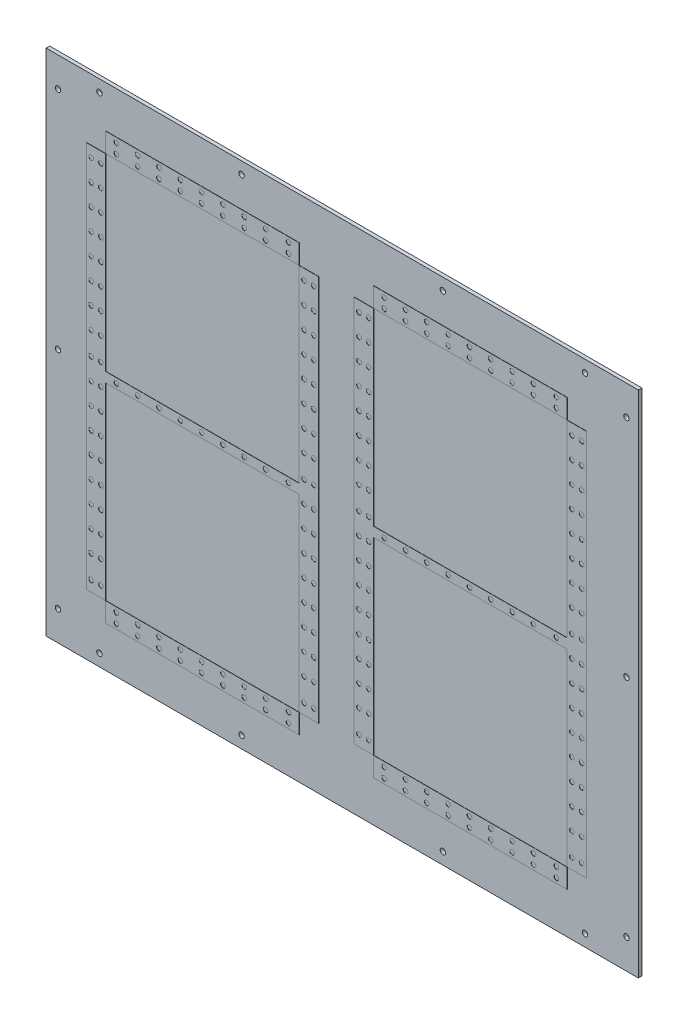
from build123d import *

# Parameters (mm, degrees)
ESBO_O4_W                = 500
ESBO_O4_H                = 430
FLANGE_BASE1_DEPTH       = 3
ESBO_O3_W                = 163.357552272
ESBO_O3_H                = 8.2
ESBO_O3_R                = 2
ESBO_O3_W_2              = 8.2
ESBO_O3_H_2              = 163.357552272
ESBO_O3_H_3              = 163.357552271
ESBO_O3_W_3              = 163.357552271
RESSALTO_EXTRUS_O1_DEPTH = 0.2
ESBO_O13_R               = 2.3
CORTE_EXTRUS_O3_DEPTH    = 3


# Sheet-metal steps are written as plain solids
with BuildPart() as part:
    # Esboço4 → Flange-base1 (new body)
    with BuildSketch(Plane.XY):
        with Locations((39.157455037, 0)):
            Rectangle(ESBO_O4_W, ESBO_O4_H)
    extrude(amount=-FLANGE_BASE1_DEPTH)

    # Esboço3 → Ressalto-extrusão1 (add)
    # profile 1 of 26: a face of its own
    with BuildSketch(Plane.XY):
        with Locations((-78.655821477, -176.090181002)):
            Rectangle(ESBO_O3_W, ESBO_O3_H)
        with Locations((-151.334597613, -176.090181002)):
            Circle(ESBO_O3_R, mode=Mode.SUBTRACT)
        with Locations((-133.334597613, -176.090181002)):
            Circle(ESBO_O3_R, mode=Mode.SUBTRACT)
        with Locations((-115.334597613, -176.090181002)):
            Circle(ESBO_O3_R, mode=Mode.SUBTRACT)
        with Locations((-97.334597613, -176.090181002)):
            Circle(ESBO_O3_R, mode=Mode.SUBTRACT)
        with Locations((-79.334597613, -176.090181002)):
            Circle(ESBO_O3_R, mode=Mode.SUBTRACT)
        with Locations((-61.334597613, -176.090181002)):
            Circle(ESBO_O3_R, mode=Mode.SUBTRACT)
        with Locations((-43.334597613, -176.090181002)):
            Circle(ESBO_O3_R, mode=Mode.SUBTRACT)
        with Locations((-25.334597613, -176.090181002)):
            Circle(ESBO_O3_R, mode=Mode.SUBTRACT)
        with Locations((-5.977045341, -176.090181002)):
            Circle(ESBO_O3_R, mode=Mode.SUBTRACT)
    # profile 2 of 26: a face of its own
    with BuildSketch(Plane.XY):
        with Locations((-78.655821477, -167.890181002)):
            Rectangle(ESBO_O3_W, ESBO_O3_H)
        with Locations((-151.334597613, -167.890181002)):
            Circle(ESBO_O3_R, mode=Mode.SUBTRACT)
        with Locations((-133.334597613, -167.890181002)):
            Circle(ESBO_O3_R, mode=Mode.SUBTRACT)
        with Locations((-115.334597613, -167.890181002)):
            Circle(ESBO_O3_R, mode=Mode.SUBTRACT)
        with Locations((-97.334597613, -167.890181002)):
            Circle(ESBO_O3_R, mode=Mode.SUBTRACT)
        with Locations((-79.334597613, -167.890181002)):
            Circle(ESBO_O3_R, mode=Mode.SUBTRACT)
        with Locations((-61.334597613, -167.890181002)):
            Circle(ESBO_O3_R, mode=Mode.SUBTRACT)
        with Locations((-43.334597613, -167.890181002)):
            Circle(ESBO_O3_R, mode=Mode.SUBTRACT)
        with Locations((-25.334597613, -167.890181002)):
            Circle(ESBO_O3_R, mode=Mode.SUBTRACT)
        with Locations((-5.977045341, -167.890181002)):
            Circle(ESBO_O3_R, mode=Mode.SUBTRACT)
    # profile 3 of 26: a face of its own
    with BuildSketch(Plane.XY):
        Polygon((-160.334597613, -4.412072557), (3.022954659, -4.412072557), (3.022954659, -0.312072557), (3.022954659, 3.787927443), (-160.334597613, 3.787927443), (-160.334597613, -0.312072557), align=None)
        with Locations((-151.334597613, -0.312072557)):
            Circle(ESBO_O3_R, mode=Mode.SUBTRACT)
        with Locations((-133.334597613, -0.312072557)):
            Circle(ESBO_O3_R, mode=Mode.SUBTRACT)
        with Locations((-115.334597613, -0.312072557)):
            Circle(ESBO_O3_R, mode=Mode.SUBTRACT)
        with Locations((-97.334597613, -0.312072557)):
            Circle(ESBO_O3_R, mode=Mode.SUBTRACT)
        with Locations((-79.334597613, -0.312072557)):
            Circle(ESBO_O3_R, mode=Mode.SUBTRACT)
        with Locations((-61.334597613, -0.312072557)):
            Circle(ESBO_O3_R, mode=Mode.SUBTRACT)
        with Locations((-43.334597613, -0.312072557)):
            Circle(ESBO_O3_R, mode=Mode.SUBTRACT)
        with Locations((-25.334597613, -0.312072557)):
            Circle(ESBO_O3_R, mode=Mode.SUBTRACT)
        with Locations((-5.977045341, -0.312072557)):
            Circle(ESBO_O3_R, mode=Mode.SUBTRACT)
    # profile 4 of 26: a face of its own
    with BuildSketch(Plane.XY):
        Polygon((3.022954659, -0.312072557), (3.022954659, -4.412072557), (3.022954659, -163.669624829), (11.222954659, -163.669624829), (11.222954659, -0.312072557), align=None)
        with Locations((7.122954659, -154.669624829)):
            Circle(ESBO_O3_R, mode=Mode.SUBTRACT)
        with Locations((7.122954659, -135.312072557)):
            Circle(ESBO_O3_R, mode=Mode.SUBTRACT)
        with Locations((7.122954659, -117.312072557)):
            Circle(ESBO_O3_R, mode=Mode.SUBTRACT)
        with Locations((7.122954659, -99.312072557)):
            Circle(ESBO_O3_R, mode=Mode.SUBTRACT)
        with Locations((7.122954659, -81.312072557)):
            Circle(ESBO_O3_R, mode=Mode.SUBTRACT)
        with Locations((7.122954659, -63.312072557)):
            Circle(ESBO_O3_R, mode=Mode.SUBTRACT)
        with Locations((7.122954659, -45.312072557)):
            Circle(ESBO_O3_R, mode=Mode.SUBTRACT)
        with Locations((7.122954659, -27.312072557)):
            Circle(ESBO_O3_R, mode=Mode.SUBTRACT)
        with Locations((7.122954659, -9.312072557)):
            Circle(ESBO_O3_R, mode=Mode.SUBTRACT)
    # profile 5 of 26: a face of its own
    with BuildSketch(Plane.XY):
        Polygon((-160.334597613, -163.669624829), (-160.334597613, -4.412072557), (-160.334597613, -0.312072557), (-168.534597613, -0.312072557), (-168.534597613, -163.669624829), align=None)
        with Locations((-164.434597613, -154.669624829)):
            Circle(ESBO_O3_R, mode=Mode.SUBTRACT)
        with Locations((-164.434597613, -135.312072557)):
            Circle(ESBO_O3_R, mode=Mode.SUBTRACT)
        with Locations((-164.434597613, -117.312072557)):
            Circle(ESBO_O3_R, mode=Mode.SUBTRACT)
        with Locations((-164.434597613, -99.312072557)):
            Circle(ESBO_O3_R, mode=Mode.SUBTRACT)
        with Locations((-164.434597613, -81.312072557)):
            Circle(ESBO_O3_R, mode=Mode.SUBTRACT)
        with Locations((-164.434597613, -63.312072557)):
            Circle(ESBO_O3_R, mode=Mode.SUBTRACT)
        with Locations((-164.434597613, -45.312072557)):
            Circle(ESBO_O3_R, mode=Mode.SUBTRACT)
        with Locations((-164.434597613, -27.312072557)):
            Circle(ESBO_O3_R, mode=Mode.SUBTRACT)
        with Locations((-164.434597613, -9.312072557)):
            Circle(ESBO_O3_R, mode=Mode.SUBTRACT)
    # profile 6 of 26: a face of its own
    with BuildSketch(Plane.XY):
        Polygon((3.022954659, 3.787927443), (3.022954659, -0.312072557), (11.222954659, -0.312072557), (11.222954659, 163.045479714), (3.022954659, 163.045479714), align=None)
        with Locations((7.122954659, 8.687927443)):
            Circle(ESBO_O3_R, mode=Mode.SUBTRACT)
        with Locations((7.122954659, 28.045479714)):
            Circle(ESBO_O3_R, mode=Mode.SUBTRACT)
        with Locations((7.122954659, 46.045479714)):
            Circle(ESBO_O3_R, mode=Mode.SUBTRACT)
        with Locations((7.122954659, 64.045479714)):
            Circle(ESBO_O3_R, mode=Mode.SUBTRACT)
        with Locations((7.122954659, 82.045479714)):
            Circle(ESBO_O3_R, mode=Mode.SUBTRACT)
        with Locations((7.122954659, 100.045479714)):
            Circle(ESBO_O3_R, mode=Mode.SUBTRACT)
        with Locations((7.122954659, 118.045479714)):
            Circle(ESBO_O3_R, mode=Mode.SUBTRACT)
        with Locations((7.122954659, 136.045479714)):
            Circle(ESBO_O3_R, mode=Mode.SUBTRACT)
        with Locations((7.122954659, 154.045479714)):
            Circle(ESBO_O3_R, mode=Mode.SUBTRACT)
    # profile 7 of 26: a face of its own
    with BuildSketch(Plane.XY):
        Polygon((-168.534597613, -0.312072557), (-160.334597613, -0.312072557), (-160.334597613, 3.787927443), (-160.334597613, 163.045479714), (-168.534597613, 163.045479714), align=None)
        with Locations((-164.434597613, 8.687927443)):
            Circle(ESBO_O3_R, mode=Mode.SUBTRACT)
        with Locations((-164.434597613, 28.045479714)):
            Circle(ESBO_O3_R, mode=Mode.SUBTRACT)
        with Locations((-164.434597613, 46.045479714)):
            Circle(ESBO_O3_R, mode=Mode.SUBTRACT)
        with Locations((-164.434597613, 64.045479714)):
            Circle(ESBO_O3_R, mode=Mode.SUBTRACT)
        with Locations((-164.434597613, 82.045479714)):
            Circle(ESBO_O3_R, mode=Mode.SUBTRACT)
        with Locations((-164.434597613, 100.045479714)):
            Circle(ESBO_O3_R, mode=Mode.SUBTRACT)
        with Locations((-164.434597613, 118.045479714)):
            Circle(ESBO_O3_R, mode=Mode.SUBTRACT)
        with Locations((-164.434597613, 136.045479714)):
            Circle(ESBO_O3_R, mode=Mode.SUBTRACT)
        with Locations((-164.434597613, 154.045479714)):
            Circle(ESBO_O3_R, mode=Mode.SUBTRACT)
    # profile 8 of 26: a face of its own
    with BuildSketch(Plane.XY):
        with Locations((15.322954659, -81.990848693)):
            Rectangle(ESBO_O3_W_2, ESBO_O3_H_2)
        with Locations((15.322954659, -154.669624829)):
            Circle(ESBO_O3_R, mode=Mode.SUBTRACT)
        with Locations((15.322954659, -135.312072557)):
            Circle(ESBO_O3_R, mode=Mode.SUBTRACT)
        with Locations((15.322954659, -117.312072557)):
            Circle(ESBO_O3_R, mode=Mode.SUBTRACT)
        with Locations((15.322954659, -99.312072557)):
            Circle(ESBO_O3_R, mode=Mode.SUBTRACT)
        with Locations((15.322954659, -81.312072557)):
            Circle(ESBO_O3_R, mode=Mode.SUBTRACT)
        with Locations((15.322954659, -63.312072557)):
            Circle(ESBO_O3_R, mode=Mode.SUBTRACT)
        with Locations((15.322954659, -45.312072557)):
            Circle(ESBO_O3_R, mode=Mode.SUBTRACT)
        with Locations((15.322954659, -27.312072557)):
            Circle(ESBO_O3_R, mode=Mode.SUBTRACT)
        with Locations((15.322954659, -9.312072557)):
            Circle(ESBO_O3_R, mode=Mode.SUBTRACT)
    # profile 9 of 26: a face of its own
    with BuildSketch(Plane.XY):
        with Locations((15.322954659, 81.366703579)):
            Rectangle(ESBO_O3_W_2, ESBO_O3_H_3)
        with Locations((15.322954659, 8.687927443)):
            Circle(ESBO_O3_R, mode=Mode.SUBTRACT)
        with Locations((15.322954659, 28.045479714)):
            Circle(ESBO_O3_R, mode=Mode.SUBTRACT)
        with Locations((15.322954659, 46.045479714)):
            Circle(ESBO_O3_R, mode=Mode.SUBTRACT)
        with Locations((15.322954659, 64.045479714)):
            Circle(ESBO_O3_R, mode=Mode.SUBTRACT)
        with Locations((15.322954659, 82.045479714)):
            Circle(ESBO_O3_R, mode=Mode.SUBTRACT)
        with Locations((15.322954659, 100.045479714)):
            Circle(ESBO_O3_R, mode=Mode.SUBTRACT)
        with Locations((15.322954659, 118.045479714)):
            Circle(ESBO_O3_R, mode=Mode.SUBTRACT)
        with Locations((15.322954659, 136.045479714)):
            Circle(ESBO_O3_R, mode=Mode.SUBTRACT)
        with Locations((15.322954659, 154.045479714)):
            Circle(ESBO_O3_R, mode=Mode.SUBTRACT)
    # profile 10 of 26: a face of its own
    with BuildSketch(Plane.XY):
        with Locations((-172.634597613, 81.366703579)):
            Rectangle(ESBO_O3_W_2, ESBO_O3_H_3)
        with Locations((-172.634597613, 8.687927443)):
            Circle(ESBO_O3_R, mode=Mode.SUBTRACT)
        with Locations((-172.634597613, 28.045479714)):
            Circle(ESBO_O3_R, mode=Mode.SUBTRACT)
        with Locations((-172.634597613, 46.045479714)):
            Circle(ESBO_O3_R, mode=Mode.SUBTRACT)
        with Locations((-172.634597613, 64.045479714)):
            Circle(ESBO_O3_R, mode=Mode.SUBTRACT)
        with Locations((-172.634597613, 82.045479714)):
            Circle(ESBO_O3_R, mode=Mode.SUBTRACT)
        with Locations((-172.634597613, 100.045479714)):
            Circle(ESBO_O3_R, mode=Mode.SUBTRACT)
        with Locations((-172.634597613, 118.045479714)):
            Circle(ESBO_O3_R, mode=Mode.SUBTRACT)
        with Locations((-172.634597613, 136.045479714)):
            Circle(ESBO_O3_R, mode=Mode.SUBTRACT)
        with Locations((-172.634597613, 154.045479714)):
            Circle(ESBO_O3_R, mode=Mode.SUBTRACT)
    # profile 11 of 26: a face of its own
    with BuildSketch(Plane.XY):
        with Locations((-172.634597613, -81.990848693)):
            Rectangle(ESBO_O3_W_2, ESBO_O3_H_2)
        with Locations((-172.634597613, -154.669624829)):
            Circle(ESBO_O3_R, mode=Mode.SUBTRACT)
        with Locations((-172.634597613, -135.312072557)):
            Circle(ESBO_O3_R, mode=Mode.SUBTRACT)
        with Locations((-172.634597613, -117.312072557)):
            Circle(ESBO_O3_R, mode=Mode.SUBTRACT)
        with Locations((-172.634597613, -99.312072557)):
            Circle(ESBO_O3_R, mode=Mode.SUBTRACT)
        with Locations((-172.634597613, -81.312072557)):
            Circle(ESBO_O3_R, mode=Mode.SUBTRACT)
        with Locations((-172.634597613, -63.312072557)):
            Circle(ESBO_O3_R, mode=Mode.SUBTRACT)
        with Locations((-172.634597613, -45.312072557)):
            Circle(ESBO_O3_R, mode=Mode.SUBTRACT)
        with Locations((-172.634597613, -27.312072557)):
            Circle(ESBO_O3_R, mode=Mode.SUBTRACT)
        with Locations((-172.634597613, -9.312072557)):
            Circle(ESBO_O3_R, mode=Mode.SUBTRACT)
    # profile 12 of 26: a face of its own
    with BuildSketch(Plane.XY):
        with Locations((-78.662362751, 167.278154522)):
            Rectangle(ESBO_O3_W_3, ESBO_O3_H)
        with Locations((-151.341138886, 167.278154522)):
            Circle(ESBO_O3_R, mode=Mode.SUBTRACT)
        with Locations((-133.341138886, 167.278154522)):
            Circle(ESBO_O3_R, mode=Mode.SUBTRACT)
        with Locations((-115.341138886, 167.278154522)):
            Circle(ESBO_O3_R, mode=Mode.SUBTRACT)
        with Locations((-97.341138886, 167.278154522)):
            Circle(ESBO_O3_R, mode=Mode.SUBTRACT)
        with Locations((-79.341138886, 167.278154522)):
            Circle(ESBO_O3_R, mode=Mode.SUBTRACT)
        with Locations((-61.341138886, 167.278154522)):
            Circle(ESBO_O3_R, mode=Mode.SUBTRACT)
        with Locations((-43.341138886, 167.278154522)):
            Circle(ESBO_O3_R, mode=Mode.SUBTRACT)
        with Locations((-25.341138886, 167.278154522)):
            Circle(ESBO_O3_R, mode=Mode.SUBTRACT)
        with Locations((-5.983586615, 167.278154522)):
            Circle(ESBO_O3_R, mode=Mode.SUBTRACT)
    # profile 13 of 26: a face of its own
    with BuildSketch(Plane.XY):
        with Locations((-78.662362751, 175.478154522)):
            Rectangle(ESBO_O3_W_3, ESBO_O3_H)
        with Locations((-151.341138886, 175.478154522)):
            Circle(ESBO_O3_R, mode=Mode.SUBTRACT)
        with Locations((-133.341138886, 175.478154522)):
            Circle(ESBO_O3_R, mode=Mode.SUBTRACT)
        with Locations((-115.341138886, 175.478154522)):
            Circle(ESBO_O3_R, mode=Mode.SUBTRACT)
        with Locations((-97.341138886, 175.478154522)):
            Circle(ESBO_O3_R, mode=Mode.SUBTRACT)
        with Locations((-79.341138886, 175.478154522)):
            Circle(ESBO_O3_R, mode=Mode.SUBTRACT)
        with Locations((-61.341138886, 175.478154522)):
            Circle(ESBO_O3_R, mode=Mode.SUBTRACT)
        with Locations((-43.341138886, 175.478154522)):
            Circle(ESBO_O3_R, mode=Mode.SUBTRACT)
        with Locations((-25.341138886, 175.478154522)):
            Circle(ESBO_O3_R, mode=Mode.SUBTRACT)
        with Locations((-5.983586615, 175.478154522)):
            Circle(ESBO_O3_R, mode=Mode.SUBTRACT)
    # profile 14 of 26: a face of its own
    with BuildSketch(Plane.XY):
        with Locations((147.501730795, -176.090181002)):
            Rectangle(ESBO_O3_W_3, ESBO_O3_H)
        with Locations((74.822954659, -176.090181002)):
            Circle(ESBO_O3_R, mode=Mode.SUBTRACT)
        with Locations((92.822954659, -176.090181002)):
            Circle(ESBO_O3_R, mode=Mode.SUBTRACT)
        with Locations((110.822954659, -176.090181002)):
            Circle(ESBO_O3_R, mode=Mode.SUBTRACT)
        with Locations((128.822954659, -176.090181002)):
            Circle(ESBO_O3_R, mode=Mode.SUBTRACT)
        with Locations((146.822954659, -176.090181002)):
            Circle(ESBO_O3_R, mode=Mode.SUBTRACT)
        with Locations((164.822954659, -176.090181002)):
            Circle(ESBO_O3_R, mode=Mode.SUBTRACT)
        with Locations((182.822954659, -176.090181002)):
            Circle(ESBO_O3_R, mode=Mode.SUBTRACT)
        with Locations((200.822954659, -176.090181002)):
            Circle(ESBO_O3_R, mode=Mode.SUBTRACT)
        with Locations((220.18050693, -176.090181002)):
            Circle(ESBO_O3_R, mode=Mode.SUBTRACT)
    # profile 15 of 26: a face of its own
    with BuildSketch(Plane.XY):
        with Locations((147.501730795, -167.890181002)):
            Rectangle(ESBO_O3_W_3, ESBO_O3_H)
        with Locations((74.822954659, -167.890181002)):
            Circle(ESBO_O3_R, mode=Mode.SUBTRACT)
        with Locations((92.822954659, -167.890181002)):
            Circle(ESBO_O3_R, mode=Mode.SUBTRACT)
        with Locations((110.822954659, -167.890181002)):
            Circle(ESBO_O3_R, mode=Mode.SUBTRACT)
        with Locations((128.822954659, -167.890181002)):
            Circle(ESBO_O3_R, mode=Mode.SUBTRACT)
        with Locations((146.822954659, -167.890181002)):
            Circle(ESBO_O3_R, mode=Mode.SUBTRACT)
        with Locations((164.822954659, -167.890181002)):
            Circle(ESBO_O3_R, mode=Mode.SUBTRACT)
        with Locations((182.822954659, -167.890181002)):
            Circle(ESBO_O3_R, mode=Mode.SUBTRACT)
        with Locations((200.822954659, -167.890181002)):
            Circle(ESBO_O3_R, mode=Mode.SUBTRACT)
        with Locations((220.18050693, -167.890181002)):
            Circle(ESBO_O3_R, mode=Mode.SUBTRACT)
    # profile 16 of 26: a face of its own
    with BuildSketch(Plane.XY):
        Polygon((65.822954659, -4.412072557), (229.18050693, -4.412072557), (229.18050693, -0.312072557), (229.18050693, 3.787927443), (65.822954659, 3.787927443), (65.822954659, -0.312072557), align=None)
        with Locations((74.822954659, -0.312072557)):
            Circle(ESBO_O3_R, mode=Mode.SUBTRACT)
        with Locations((92.822954659, -0.312072557)):
            Circle(ESBO_O3_R, mode=Mode.SUBTRACT)
        with Locations((110.822954659, -0.312072557)):
            Circle(ESBO_O3_R, mode=Mode.SUBTRACT)
        with Locations((128.822954659, -0.312072557)):
            Circle(ESBO_O3_R, mode=Mode.SUBTRACT)
        with Locations((146.822954659, -0.312072557)):
            Circle(ESBO_O3_R, mode=Mode.SUBTRACT)
        with Locations((164.822954659, -0.312072557)):
            Circle(ESBO_O3_R, mode=Mode.SUBTRACT)
        with Locations((182.822954659, -0.312072557)):
            Circle(ESBO_O3_R, mode=Mode.SUBTRACT)
        with Locations((200.822954659, -0.312072557)):
            Circle(ESBO_O3_R, mode=Mode.SUBTRACT)
        with Locations((220.18050693, -0.312072557)):
            Circle(ESBO_O3_R, mode=Mode.SUBTRACT)
    # profile 17 of 26: a face of its own
    with BuildSketch(Plane.XY):
        Polygon((229.18050693, -0.312072557), (229.18050693, -4.412072557), (229.18050693, -163.669624829), (237.38050693, -163.669624829), (237.38050693, -0.312072557), align=None)
        with Locations((233.28050693, -154.669624829)):
            Circle(ESBO_O3_R, mode=Mode.SUBTRACT)
        with Locations((233.28050693, -135.312072557)):
            Circle(ESBO_O3_R, mode=Mode.SUBTRACT)
        with Locations((233.28050693, -117.312072557)):
            Circle(ESBO_O3_R, mode=Mode.SUBTRACT)
        with Locations((233.28050693, -99.312072557)):
            Circle(ESBO_O3_R, mode=Mode.SUBTRACT)
        with Locations((233.28050693, -81.312072557)):
            Circle(ESBO_O3_R, mode=Mode.SUBTRACT)
        with Locations((233.28050693, -63.312072557)):
            Circle(ESBO_O3_R, mode=Mode.SUBTRACT)
        with Locations((233.28050693, -45.312072557)):
            Circle(ESBO_O3_R, mode=Mode.SUBTRACT)
        with Locations((233.28050693, -27.312072557)):
            Circle(ESBO_O3_R, mode=Mode.SUBTRACT)
        with Locations((233.28050693, -9.312072557)):
            Circle(ESBO_O3_R, mode=Mode.SUBTRACT)
    # profile 18 of 26: a face of its own
    with BuildSketch(Plane.XY):
        Polygon((65.822954659, -163.669624829), (65.822954659, -4.412072557), (65.822954659, -0.312072557), (57.622954659, -0.312072557), (57.622954659, -163.669624829), align=None)
        with Locations((61.722954659, -154.669624829)):
            Circle(ESBO_O3_R, mode=Mode.SUBTRACT)
        with Locations((61.722954659, -135.312072557)):
            Circle(ESBO_O3_R, mode=Mode.SUBTRACT)
        with Locations((61.722954659, -117.312072557)):
            Circle(ESBO_O3_R, mode=Mode.SUBTRACT)
        with Locations((61.722954659, -99.312072557)):
            Circle(ESBO_O3_R, mode=Mode.SUBTRACT)
        with Locations((61.722954659, -81.312072557)):
            Circle(ESBO_O3_R, mode=Mode.SUBTRACT)
        with Locations((61.722954659, -63.312072557)):
            Circle(ESBO_O3_R, mode=Mode.SUBTRACT)
        with Locations((61.722954659, -45.312072557)):
            Circle(ESBO_O3_R, mode=Mode.SUBTRACT)
        with Locations((61.722954659, -27.312072557)):
            Circle(ESBO_O3_R, mode=Mode.SUBTRACT)
        with Locations((61.722954659, -9.312072557)):
            Circle(ESBO_O3_R, mode=Mode.SUBTRACT)
    # profile 19 of 26: a face of its own
    with BuildSketch(Plane.XY):
        Polygon((229.18050693, 3.787927443), (229.18050693, -0.312072557), (237.38050693, -0.312072557), (237.38050693, 163.045479714), (229.18050693, 163.045479714), align=None)
        with Locations((233.28050693, 8.687927443)):
            Circle(ESBO_O3_R, mode=Mode.SUBTRACT)
        with Locations((233.28050693, 28.045479714)):
            Circle(ESBO_O3_R, mode=Mode.SUBTRACT)
        with Locations((233.28050693, 46.045479714)):
            Circle(ESBO_O3_R, mode=Mode.SUBTRACT)
        with Locations((233.28050693, 64.045479714)):
            Circle(ESBO_O3_R, mode=Mode.SUBTRACT)
        with Locations((233.28050693, 82.045479714)):
            Circle(ESBO_O3_R, mode=Mode.SUBTRACT)
        with Locations((233.28050693, 100.045479714)):
            Circle(ESBO_O3_R, mode=Mode.SUBTRACT)
        with Locations((233.28050693, 118.045479714)):
            Circle(ESBO_O3_R, mode=Mode.SUBTRACT)
        with Locations((233.28050693, 136.045479714)):
            Circle(ESBO_O3_R, mode=Mode.SUBTRACT)
        with Locations((233.28050693, 154.045479714)):
            Circle(ESBO_O3_R, mode=Mode.SUBTRACT)
    # profile 20 of 26: a face of its own
    with BuildSketch(Plane.XY):
        Polygon((57.622954659, -0.312072557), (65.822954659, -0.312072557), (65.822954659, 3.787927443), (65.822954659, 163.045479714), (57.622954659, 163.045479714), align=None)
        with Locations((61.722954659, 8.687927443)):
            Circle(ESBO_O3_R, mode=Mode.SUBTRACT)
        with Locations((61.722954659, 28.045479714)):
            Circle(ESBO_O3_R, mode=Mode.SUBTRACT)
        with Locations((61.722954659, 46.045479714)):
            Circle(ESBO_O3_R, mode=Mode.SUBTRACT)
        with Locations((61.722954659, 64.045479714)):
            Circle(ESBO_O3_R, mode=Mode.SUBTRACT)
        with Locations((61.722954659, 82.045479714)):
            Circle(ESBO_O3_R, mode=Mode.SUBTRACT)
        with Locations((61.722954659, 100.045479714)):
            Circle(ESBO_O3_R, mode=Mode.SUBTRACT)
        with Locations((61.722954659, 118.045479714)):
            Circle(ESBO_O3_R, mode=Mode.SUBTRACT)
        with Locations((61.722954659, 136.045479714)):
            Circle(ESBO_O3_R, mode=Mode.SUBTRACT)
        with Locations((61.722954659, 154.045479714)):
            Circle(ESBO_O3_R, mode=Mode.SUBTRACT)
    # profile 21 of 26: a face of its own
    with BuildSketch(Plane.XY):
        with Locations((241.48050693, -81.990848693)):
            Rectangle(ESBO_O3_W_2, ESBO_O3_H_2)
        with Locations((241.48050693, -154.669624829)):
            Circle(ESBO_O3_R, mode=Mode.SUBTRACT)
        with Locations((241.48050693, -135.312072557)):
            Circle(ESBO_O3_R, mode=Mode.SUBTRACT)
        with Locations((241.48050693, -117.312072557)):
            Circle(ESBO_O3_R, mode=Mode.SUBTRACT)
        with Locations((241.48050693, -99.312072557)):
            Circle(ESBO_O3_R, mode=Mode.SUBTRACT)
        with Locations((241.48050693, -81.312072557)):
            Circle(ESBO_O3_R, mode=Mode.SUBTRACT)
        with Locations((241.48050693, -63.312072557)):
            Circle(ESBO_O3_R, mode=Mode.SUBTRACT)
        with Locations((241.48050693, -45.312072557)):
            Circle(ESBO_O3_R, mode=Mode.SUBTRACT)
        with Locations((241.48050693, -27.312072557)):
            Circle(ESBO_O3_R, mode=Mode.SUBTRACT)
        with Locations((241.48050693, -9.312072557)):
            Circle(ESBO_O3_R, mode=Mode.SUBTRACT)
    # profile 22 of 26: a face of its own
    with BuildSketch(Plane.XY):
        with Locations((241.48050693, 81.366703579)):
            Rectangle(ESBO_O3_W_2, ESBO_O3_H_3)
        with Locations((241.48050693, 8.687927443)):
            Circle(ESBO_O3_R, mode=Mode.SUBTRACT)
        with Locations((241.48050693, 28.045479714)):
            Circle(ESBO_O3_R, mode=Mode.SUBTRACT)
        with Locations((241.48050693, 46.045479714)):
            Circle(ESBO_O3_R, mode=Mode.SUBTRACT)
        with Locations((241.48050693, 64.045479714)):
            Circle(ESBO_O3_R, mode=Mode.SUBTRACT)
        with Locations((241.48050693, 82.045479714)):
            Circle(ESBO_O3_R, mode=Mode.SUBTRACT)
        with Locations((241.48050693, 100.045479714)):
            Circle(ESBO_O3_R, mode=Mode.SUBTRACT)
        with Locations((241.48050693, 118.045479714)):
            Circle(ESBO_O3_R, mode=Mode.SUBTRACT)
        with Locations((241.48050693, 136.045479714)):
            Circle(ESBO_O3_R, mode=Mode.SUBTRACT)
        with Locations((241.48050693, 154.045479714)):
            Circle(ESBO_O3_R, mode=Mode.SUBTRACT)
    # profile 23 of 26: a face of its own
    with BuildSketch(Plane.XY):
        with Locations((53.522954659, 81.366703579)):
            Rectangle(ESBO_O3_W_2, ESBO_O3_H_3)
        with Locations((53.522954659, 8.687927443)):
            Circle(ESBO_O3_R, mode=Mode.SUBTRACT)
        with Locations((53.522954659, 28.045479714)):
            Circle(ESBO_O3_R, mode=Mode.SUBTRACT)
        with Locations((53.522954659, 46.045479714)):
            Circle(ESBO_O3_R, mode=Mode.SUBTRACT)
        with Locations((53.522954659, 64.045479714)):
            Circle(ESBO_O3_R, mode=Mode.SUBTRACT)
        with Locations((53.522954659, 82.045479714)):
            Circle(ESBO_O3_R, mode=Mode.SUBTRACT)
        with Locations((53.522954659, 100.045479714)):
            Circle(ESBO_O3_R, mode=Mode.SUBTRACT)
        with Locations((53.522954659, 118.045479714)):
            Circle(ESBO_O3_R, mode=Mode.SUBTRACT)
        with Locations((53.522954659, 136.045479714)):
            Circle(ESBO_O3_R, mode=Mode.SUBTRACT)
        with Locations((53.522954659, 154.045479714)):
            Circle(ESBO_O3_R, mode=Mode.SUBTRACT)
    # profile 24 of 26: a face of its own
    with BuildSketch(Plane.XY):
        with Locations((53.522954659, -81.990848693)):
            Rectangle(ESBO_O3_W_2, ESBO_O3_H_2)
        with Locations((53.522954659, -154.669624829)):
            Circle(ESBO_O3_R, mode=Mode.SUBTRACT)
        with Locations((53.522954659, -135.312072557)):
            Circle(ESBO_O3_R, mode=Mode.SUBTRACT)
        with Locations((53.522954659, -117.312072557)):
            Circle(ESBO_O3_R, mode=Mode.SUBTRACT)
        with Locations((53.522954659, -99.312072557)):
            Circle(ESBO_O3_R, mode=Mode.SUBTRACT)
        with Locations((53.522954659, -81.312072557)):
            Circle(ESBO_O3_R, mode=Mode.SUBTRACT)
        with Locations((53.522954659, -63.312072557)):
            Circle(ESBO_O3_R, mode=Mode.SUBTRACT)
        with Locations((53.522954659, -45.312072557)):
            Circle(ESBO_O3_R, mode=Mode.SUBTRACT)
        with Locations((53.522954659, -27.312072557)):
            Circle(ESBO_O3_R, mode=Mode.SUBTRACT)
        with Locations((53.522954659, -9.312072557)):
            Circle(ESBO_O3_R, mode=Mode.SUBTRACT)
    # profile 25 of 26: a face of its own
    with BuildSketch(Plane.XY):
        with Locations((147.495189521, 167.278154522)):
            Rectangle(ESBO_O3_W, ESBO_O3_H)
        with Locations((74.816413385, 167.278154522)):
            Circle(ESBO_O3_R, mode=Mode.SUBTRACT)
        with Locations((92.816413385, 167.278154522)):
            Circle(ESBO_O3_R, mode=Mode.SUBTRACT)
        with Locations((110.816413385, 167.278154522)):
            Circle(ESBO_O3_R, mode=Mode.SUBTRACT)
        with Locations((128.816413385, 167.278154522)):
            Circle(ESBO_O3_R, mode=Mode.SUBTRACT)
        with Locations((146.816413385, 167.278154522)):
            Circle(ESBO_O3_R, mode=Mode.SUBTRACT)
        with Locations((164.816413385, 167.278154522)):
            Circle(ESBO_O3_R, mode=Mode.SUBTRACT)
        with Locations((182.816413385, 167.278154522)):
            Circle(ESBO_O3_R, mode=Mode.SUBTRACT)
        with Locations((200.816413385, 167.278154522)):
            Circle(ESBO_O3_R, mode=Mode.SUBTRACT)
        with Locations((220.173965657, 167.278154522)):
            Circle(ESBO_O3_R, mode=Mode.SUBTRACT)
    # profile 26 of 26: a face of its own
    with BuildSketch(Plane.XY):
        with Locations((147.495189521, 175.478154522)):
            Rectangle(ESBO_O3_W, ESBO_O3_H)
        with Locations((74.816413385, 175.478154522)):
            Circle(ESBO_O3_R, mode=Mode.SUBTRACT)
        with Locations((92.816413385, 175.478154522)):
            Circle(ESBO_O3_R, mode=Mode.SUBTRACT)
        with Locations((110.816413385, 175.478154522)):
            Circle(ESBO_O3_R, mode=Mode.SUBTRACT)
        with Locations((128.816413385, 175.478154522)):
            Circle(ESBO_O3_R, mode=Mode.SUBTRACT)
        with Locations((146.816413385, 175.478154522)):
            Circle(ESBO_O3_R, mode=Mode.SUBTRACT)
        with Locations((164.816413385, 175.478154522)):
            Circle(ESBO_O3_R, mode=Mode.SUBTRACT)
        with Locations((182.816413385, 175.478154522)):
            Circle(ESBO_O3_R, mode=Mode.SUBTRACT)
        with Locations((200.816413385, 175.478154522)):
            Circle(ESBO_O3_R, mode=Mode.SUBTRACT)
        with Locations((220.173965657, 175.478154522)):
            Circle(ESBO_O3_R, mode=Mode.SUBTRACT)
    extrude(amount=RESSALTO_EXTRUS_O1_DEPTH)

    # Esboço13 → Corte-extrusão3 (cut)
    with BuildSketch(Plane.XY):
        with Locations((-165.842544963, 205)):
            Circle(ESBO_O13_R)
        with Locations((-200.842544963, 190)):
            Circle(ESBO_O13_R)
        with Locations((-45.842544963, 205)):
            Circle(ESBO_O13_R)
        with Locations(Location((124.157455037, 205, 0), (0, 0, 180))):
            Circle(ESBO_O13_R)
        with Locations(Location((244.157455037, 205, 0), (0, 0, 180))):
            Circle(ESBO_O13_R)
        with Locations(Location((279.157455037, 190, 0), (0, 0, 180))):
            Circle(ESBO_O13_R)
        with Locations((279.157455037, -190)):
            Circle(ESBO_O13_R)
        with Locations((244.157455037, -205)):
            Circle(ESBO_O13_R)
        with Locations((124.157455037, -205)):
            Circle(ESBO_O13_R)
        with Locations(Location((-45.842544963, -205, 0), (0, 0, 180))):
            Circle(ESBO_O13_R)
        with Locations(Location((-200.842544963, -190, 0), (0, 0, 180))):
            Circle(ESBO_O13_R)
        with Locations(Location((-165.842544963, -205, 0), (0, 0, 180))):
            Circle(ESBO_O13_R)
        with Locations((240, 0)):
            Circle(ESBO_O13_R)
        with Locations((-200.842544963, -0.312072557)):
            Circle(ESBO_O13_R)
        with Locations((279.157455037, 0)):
            Circle(ESBO_O13_R)
    extrude(amount=-CORTE_EXTRUS_O3_DEPTH, mode=Mode.SUBTRACT)


solid = part.part
